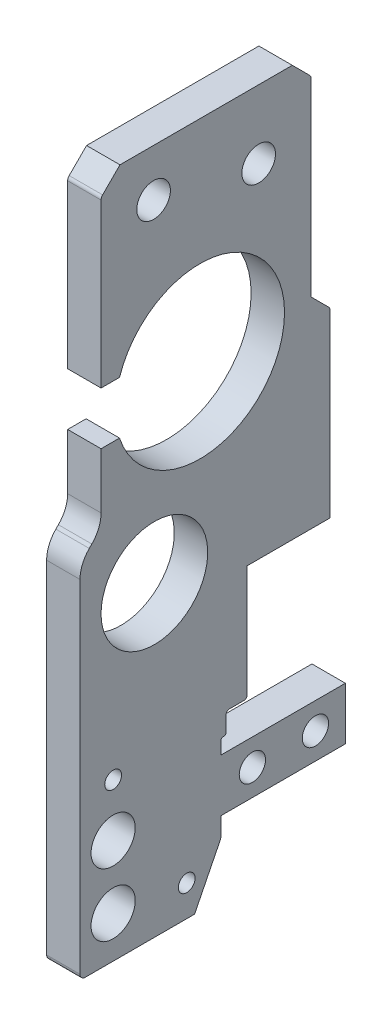
from build123d import *

# Parameters (mm, degrees)
SKETCH1_R             = 5.075
SKETCH1_R_2           = 1.6
SKETCH1_R_3           = 1.25
SKETCH1_R_4           = 2.1
SKETCH1_R_5           = 0.8
BOSS_EXTRUDE1_DEPTH   = 3.18
CHAMFER1_SIZE         = 2.5
CHAMFER1_SIZE2        = 4.998920521
FILLET2_R             = 3
CHAMFER2_SIZE         = 1.8
FILLET4_R             = 0.5
FILLET7_R             = 0.2
M3X0_5_TAPPED_HOLE1_D = 2.5
M2_TAPPED_HOLE1_D     = 1.6
FILLET8_R             = 0.3
CUT_EXTRUDE5_DEPTH    = 4


with BuildPart() as part:
    # Sketch1 → Boss-Extrude1 (new body)
    with BuildSketch(Plane(origin=(0, 0, 0), x_dir=(0, 0, -1), z_dir=(1, 0, 0))):
        Polygon((0, 0), (0, 34.275), (2, 36.275), (2, 65.31), (22, 65.31), (22, 45.31), (23.8, 45.31), (23.8, 26.21), (15.9, 26.21), (15.9, 15.26), (13.9, 15.26), (13.9, 13.26), (13.4, 13.26), (13.4, 11.86), (25.25, 11.86), (25.25, 6.86), (13.4, 6.86), (13.4, 0), align=None)
        with Locations(Location((7.075, 29.2, 0), (0, 0, 180))):
            Circle(SKETCH1_R, mode=Mode.SUBTRACT)
        with Locations(Location((7, 60.81, 0), (0, 0, 180))):
            Circle(SKETCH1_R_2, mode=Mode.SUBTRACT)
        with Locations(Location((17, 58.81, 0), (0, 0, 180))):
            Circle(SKETCH1_R_2, mode=Mode.SUBTRACT)
        with Locations(Location((22.4, 9.36, 0), (0, 0, 180))):
            Circle(SKETCH1_R_3, mode=Mode.SUBTRACT)
        with Locations(Location((16.4, 9.36, 0), (0, 0, 180))):
            Circle(SKETCH1_R_3, mode=Mode.SUBTRACT)
        with Locations(Location((3.15, 3.95, 0), (0, 0, 180))):
            Circle(SKETCH1_R_4, mode=Mode.SUBTRACT)
        with Locations(Location((3.15, 9.95, 0), (0, 0, 180))):
            Circle(SKETCH1_R_4, mode=Mode.SUBTRACT)
        with Locations(Location((10.15, 2.95, 0), (0, 0, 180))):
            Circle(SKETCH1_R_5, mode=Mode.SUBTRACT)
        with Locations(Location((3.15, 14.95, 0), (0, 0, 180))):
            Circle(SKETCH1_R_5, mode=Mode.SUBTRACT)
    extrude(amount=BOSS_EXTRUDE1_DEPTH)

    # Chamfer1
    chamfer1_edges = [part.edges().sort_by_distance(p)[0] for p in [
        (1.59, 0, -13.4),
    ]]
    chamfer1_side = [part.faces().sort_by_distance(p)[0] for p in [
        (1.59, 0, -6.7),
    ]]
    chamfer(chamfer1_edges, length=CHAMFER1_SIZE, length2=CHAMFER1_SIZE2, reference=chamfer1_side[0])

    # Fillet2
    fillet2_edges = [part.edges().sort_by_distance(p)[0] for p in [
        (1.59, 34.275, 0),
        (1.59, 36.275, -2),
    ]]
    fillet(fillet2_edges, radius=FILLET2_R)

    # Chamfer2
    chamfer2_edges = [part.edges().sort_by_distance(p)[0] for p in [
        (1.59, 65.31, -22),
        (1.59, 65.31, -2),
        (1.59, 45.31, -23.8),
    ]]
    chamfer(chamfer2_edges, length=CHAMFER2_SIZE - 0.0001)  # a hair under: the kernel refuses the full size

    # Fillet4
    fillet4_edges = [part.edges().sort_by_distance(p)[0] for p in [
        (1.59, 43.5101, -23.8),
        (1.59, 63.5101, -22),
        (1.59, 63.5101, -2),
        (1.59, 0, 0),
        (1.59, 4.998920521, -13.4),
    ]]
    fillet(fillet4_edges, radius=FILLET4_R)

    # Fillet7
    fillet7_edges = [part.edges().sort_by_distance(p)[0] for p in [
        (1.59, 13.26, -13.9),
        (1.59, 13.26, -13.4),
    ]]
    fillet(fillet7_edges, radius=FILLET7_R)

    # M3x0.5 Tapped Hole1 (through all)
    with Locations(Plane(origin=(3.18, 0, 0), x_dir=(0, 0, -1), z_dir=(1, 0, 0))):
        with Locations((16.4, 9.36), (22.4, 9.36)):
            Hole(M3X0_5_TAPPED_HOLE1_D / 2)

    # M2 Tapped Hole1 (through all)
    with Locations(Plane(origin=(0, 14.95, -3.15), x_dir=(0, 0, -1), z_dir=(-1, 0, 0))):
        with Locations((0, 0), (7, 12)):
            Hole(M2_TAPPED_HOLE1_D / 2)

    # Fillet8
    fillet8_edges = [part.edges().sort_by_distance(p)[0] for p in [
        (1.59, 15.26, -15.9),
        (1.59, 15.26, -13.9),
    ]]
    fillet(fillet8_edges, radius=FILLET8_R)

    # Sketch13 → Cut-Extrude5 (cut)
    with BuildSketch(Plane(origin=(3.18, 0, 0), x_dir=(0, 0, -1), z_dir=(1, 0, 0))):
        with BuildLine():
            Line((2, 42.81), (3.758141467, 42.81))
            ThreePointArc((3.758141467, 42.81), (19.460102, 45.31), (3.758141467, 47.81))
            Line((3.758141467, 47.81), (2, 47.81))
            Line((2, 47.81), (2, 42.81))
        make_face()
    extrude(amount=-CUT_EXTRUDE5_DEPTH, mode=Mode.SUBTRACT)


solid = part.part
